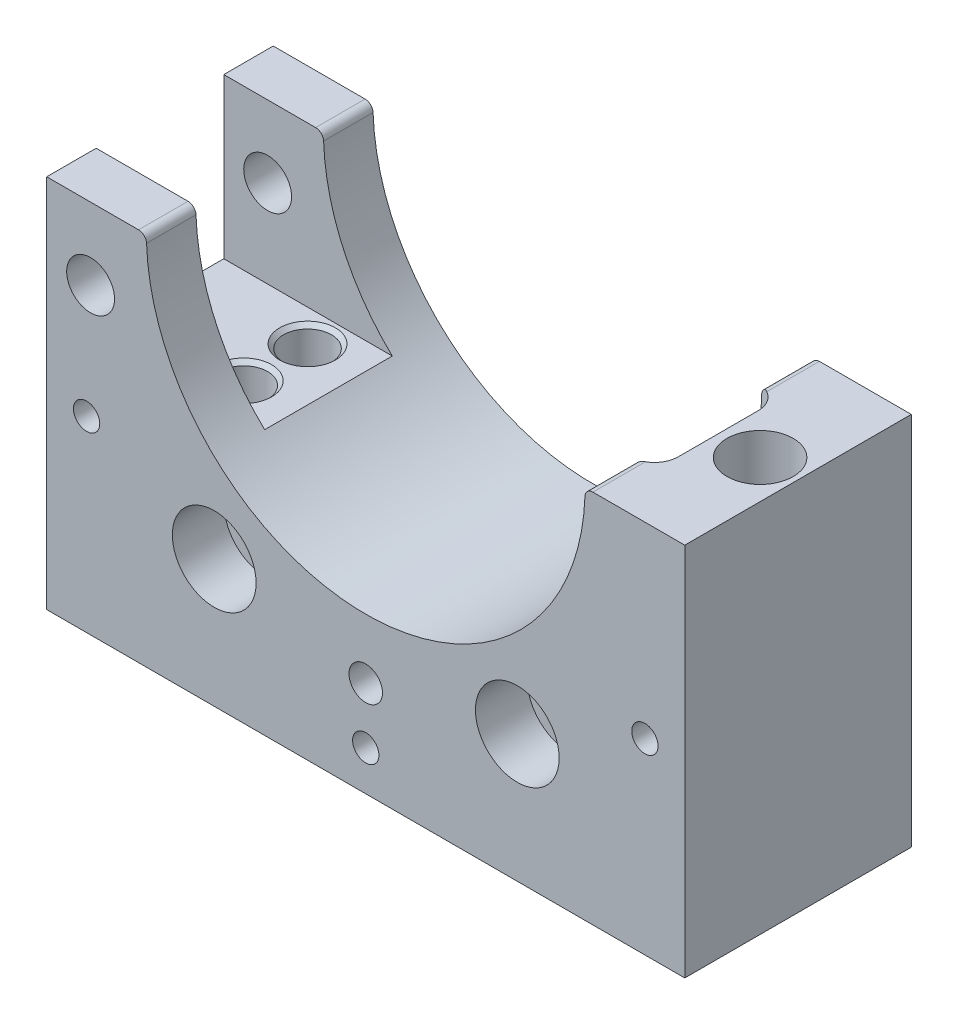
from build123d import *

# Parameters (mm, degrees)
EXTRUDE_1_DEPTH             = 28.4
SKETCH_2_W                  = 140
SKETCH_2_H                  = 16
CUT_EXTRUDE_1_DEPTH         = 20
FILLET_1_R                  = 3
SKETCH_3_R                  = 3
SKETCH_3_R_2                = 3.05
CUT_EXTRUDE_2_DEPTH         = 56.996071341
CHAMFER_1_SIZE              = 0.5
SKETCH_4_R                  = 3
CUT_EXTRUDE_3_DEPTH         = 55.394944713
SKETCH_7_R                  = 4.15
CUT_EXTRUDE_4_DEPTH         = 18
HOLE_WIZARD_M6_2_D          = 5
SKETCH_10_R                 = 3.1
CUT_EXTRUDE_5_DEPTH         = 55.394944713
HOLE_WIZARD_M5_1_D          = 4.2
HOLE_WIZARD_M5_1_DEPTH      = 14.4
HOLE_WIZARD_M5_1_TIP        = 1.2618073
HOLE_WIZARD_M5_2_D          = 4.2
HOLE_WIZARD_M5_2_DEPTH      = 14.4
HOLE_WIZARD_M5_2_TIP        = 1.2618073
FILLET_2_R                  = 1
SKETCH_17_R                 = 5.25
CUT_EXTRUDE_7_DEPTH         = 6.5
HOLE_WIZARD_M4_1_AT_2_COUNT = 2
HOLE_WIZARD_M4_1_AT_2_PITCH = 70
HOLE_WIZARD_M4_1_AT_3_COUNT = 2
HOLE_WIZARD_M4_1_AT_3_PITCH = 39.588508434


with BuildPart() as part:
    # 草图1 → 凸台-拉伸1 (new body)
    with BuildSketch(Plane.XY):
        with BuildLine():
            Line((27.5, 23.5), (40, 23.5))
            Line((40, 23.5), (40, -23.5))
            Line((40, -23.5), (-40, -23.5))
            Line((-40, -23.5), (-40, 23.5))
            Line((-40, 23.5), (-27.5, 23.5))
            ThreePointArc((-27.5, 23.5), (0, -4), (27.5, 23.5))
        make_face()
    extrude(amount=EXTRUDE_1_DEPTH)

    # 草图2 → 切除-拉伸1 (cut)
    with BuildSketch(Plane(origin=(0, 23.5, 0), x_dir=(1, 0, 0), z_dir=(0, 1, 0))):
        with Locations((-40, -14.2)):
            Rectangle(SKETCH_2_W, SKETCH_2_H)
    extrude(amount=-CUT_EXTRUDE_1_DEPTH, mode=Mode.SUBTRACT)

    # 圆角1
    # the kernel refuses this fillet: 3 mm, written as the material it adds along each edge
    with BuildSketch(Plane(origin=(30, 23.5, 22.2), x_dir=(-1, 0, 0), z_dir=(0, -1, 0))) as fillet_1_piece_1_section:
        with BuildLine():
            CenterArc((FILLET_1_R, FILLET_1_R), FILLET_1_R, 180, 90)
            Line((0, FILLET_1_R), (0, 0))
            Line((0, 0), (FILLET_1_R, 0))
        make_face()
    fillet_1_piece_1 = extrude(amount=27.5, mode=Mode.PRIVATE)
    fillet_1_piece_1 = fillet_1_piece_1 - Plane(origin=(0, 23.5, 21.518950585), x_dir=(-1, 0, 0), z_dir=(0, 0, -1)) * Cylinder(27.5, 67, mode=Mode.PRIVATE)
    add(fillet_1_piece_1)
    with BuildSketch(Plane(origin=(30, 23.5, 6.2), x_dir=(0, 0, 1), z_dir=(0, -1, 0))) as fillet_1_piece_2_section:
        with BuildLine():
            CenterArc((FILLET_1_R, FILLET_1_R), FILLET_1_R, 180, 90)
            Line((0, FILLET_1_R), (0, 0))
            Line((0, 0), (FILLET_1_R, 0))
        make_face()
    fillet_1_piece_2 = extrude(amount=27.5, mode=Mode.PRIVATE)
    fillet_1_piece_2 = fillet_1_piece_2 - Plane(origin=(0, 23.5, 6.881049416), x_dir=(-1, 0, 0), z_dir=(0, 0, -1)) * Cylinder(27.5, 68, mode=Mode.PRIVATE)
    add(fillet_1_piece_2)

    # 草图3 → 切除-拉伸2 (cut, through all)
    with BuildSketch(Plane(origin=(0, 3.5, 0), x_dir=(1, 0, 0), z_dir=(0, 1, 0))):
        with Locations(Location((-25.5, -10.2, 0), (0, 0, 270))):
            Circle(SKETCH_3_R)
        with Locations(Location((-25.5, -18.2, 0), (0, 0, 90))):
            Circle(SKETCH_3_R)
        with Locations(Location((25.5, -10.2, 0), (0, 0, 270))):
            Circle(SKETCH_3_R_2)
        with Locations(Location((25.5, -18.2, 0), (0, 0, 90))):
            Circle(SKETCH_3_R_2)
    extrude(amount=-CUT_EXTRUDE_2_DEPTH, mode=Mode.SUBTRACT)

    # 倒角1
    chamfer_1_edges = [part.edges().sort_by_distance(p)[0] for p in [
        (-25.5, 3.5, 7.2),
        (-25.5, 3.5, 21.2),
        (25.5, 3.5, 7.15),
        (25.5, 3.5, 21.25),
    ]]
    chamfer(chamfer_1_edges, length=CHAMFER_1_SIZE)

    # 草图4 → 切除-拉伸3 (cut, through all)
    with BuildSketch(Plane.XY.offset(28.4)):
        with Locations((-34.499379308, 14.475094051)):
            Circle(SKETCH_4_R)
    extrude(amount=-CUT_EXTRUDE_3_DEPTH, mode=Mode.SUBTRACT)

    # 草图7 → 切除-拉伸4 (cut)
    with BuildSketch(Plane(origin=(0, 23.5, 0), x_dir=(1, 0, 0), z_dir=(0, 1, 0))):
        with Locations(Location((35.2, -14.155033758, 0), (0, 0, 180))):
            Circle(SKETCH_7_R)
    extrude(amount=-CUT_EXTRUDE_4_DEPTH, mode=Mode.SUBTRACT)

    # M6 螺纹孔2 (through all)
    with Locations(Plane(origin=(0, 5.5, 0), x_dir=(1, 0, 0), z_dir=(0, 1, 0))):
        with Locations((35.2, -14.155033758)):
            Hole(HOLE_WIZARD_M6_2_D / 2)

    # 草图10 → 切除-拉伸5 (cut, through all)
    with BuildSketch(Plane.XY.offset(28.4)):
        with Locations((-19, -7.5)):
            Circle(SKETCH_10_R)
        with Locations(Location((19, -7.5, 0), (0, 0, 180))):
            Circle(SKETCH_10_R)
    extrude(amount=-CUT_EXTRUDE_5_DEPTH, mode=Mode.SUBTRACT)

    # M5 螺纹孔1
    with Locations(Plane.XY.offset(28.4)):
        with Locations((0, -11.5)):
            Hole(HOLE_WIZARD_M5_1_D / 2, depth=HOLE_WIZARD_M5_1_DEPTH)
            with Locations((0, 0, -(HOLE_WIZARD_M5_1_DEPTH + HOLE_WIZARD_M5_1_TIP / 2))):  # 118° drill point
                Cone(0, HOLE_WIZARD_M5_1_D / 2, HOLE_WIZARD_M5_1_TIP, mode=Mode.SUBTRACT)

    # M5 螺纹孔2
    with Locations(Plane(origin=(0, 0, 0), x_dir=(-1, 0, 0), z_dir=(0, 0, -1))):
        with Locations((0, -11.5)):
            Hole(HOLE_WIZARD_M5_2_D / 2, depth=HOLE_WIZARD_M5_2_DEPTH)
            with Locations((0, 0, -(HOLE_WIZARD_M5_2_DEPTH + HOLE_WIZARD_M5_2_TIP / 2))):  # 118° drill point
                Cone(0, HOLE_WIZARD_M5_2_D / 2, HOLE_WIZARD_M5_2_TIP, mode=Mode.SUBTRACT)

    # 圆角2
    fillet_2_edges = [part.edges().sort_by_distance(p)[0] for p in [
        (27.5, 23.5, 25.279019946),
        (27.5, 23.5, 3.120980054),
        (-27.5, 23.5, 25.3),
        (-27.5, 23.5, 3.1),
    ]]
    fillet(fillet_2_edges, radius=FILLET_2_R)

    # 草图17 → 切除-拉伸7 (cut)
    with BuildSketch(Plane(origin=(0, 0, 0), x_dir=(-1, 0, 0), z_dir=(0, 0, -1))):
        with Locations((-19, -7.5)):
            Circle(SKETCH_17_R)
        with Locations((19, -7.5)):
            Circle(SKETCH_17_R)
    cut_extrude_7 = extrude(amount=-CUT_EXTRUDE_7_DEPTH, mode=Mode.SUBTRACT)

    # 镜向3: 切除-拉伸7 across plane
    add(cut_extrude_7.mirror(Plane.XY.offset(14.2)), mode=Mode.SUBTRACT)

    # 草图18 → M4 螺纹孔1 (revolve, cut)
    with BuildSketch(Plane(origin=(-35, 0, 28.4), x_dir=(0, -1, 0), z_dir=(1, 0, 0))):
        Polygon((0, 0), (0, 10.991420021), (1.65, 10), (1.65, 0), align=None)
    hole_wizard_m4_1 = revolve(axis=Axis((-35, 0, 34.75), (0, 0, -1)), mode=Mode.SUBTRACT)

    # M4 螺纹孔1 at 2: M4 螺纹孔1 ×2
    with Locations(*[(i * HOLE_WIZARD_M4_1_AT_2_PITCH, 0, 0) for i in range(1, HOLE_WIZARD_M4_1_AT_2_COUNT)]):
        add(hole_wizard_m4_1, mode=Mode.SUBTRACT)

    # M4 螺纹孔1 at 3: M4 螺纹孔1 ×2
    with Locations(*[Vector(0.8840949402949304, -0.46730732558446325, 0) * (i * HOLE_WIZARD_M4_1_AT_3_PITCH) for i in range(1, HOLE_WIZARD_M4_1_AT_3_COUNT)]):
        add(hole_wizard_m4_1, mode=Mode.SUBTRACT)

    # 镜向4: M4 螺纹孔1 across plane
    add(hole_wizard_m4_1.mirror(Plane.XY.offset(14.2)), mode=Mode.SUBTRACT)

    # 镜向4 copy 1 sketch → 镜向4 copy 1 (revolve, cut)
    with BuildSketch(Plane(origin=(35, 0, 0), x_dir=(0, -1, 0), z_dir=(1, 0, 0))):
        Polygon((0, 0), (0, -10.991420021), (1.65, -10), (1.65, 0), align=None)
    revolve(axis=Axis((35, 0, -6.35), (0, 0, -1)), mode=Mode.SUBTRACT)

    # 镜向4 copy 2 sketch → 镜向4 copy 2 (revolve, cut)
    with BuildSketch(Plane(origin=(0, -18.5, 0), x_dir=(0, -1, 0), z_dir=(1, 0, 0))):
        Polygon((0, 0), (0, -10.991420021), (1.65, -10), (1.65, 0), align=None)
    revolve(axis=Axis((0, -18.5, -6.35), (0, 0, -1)), mode=Mode.SUBTRACT)


solid = part.part
